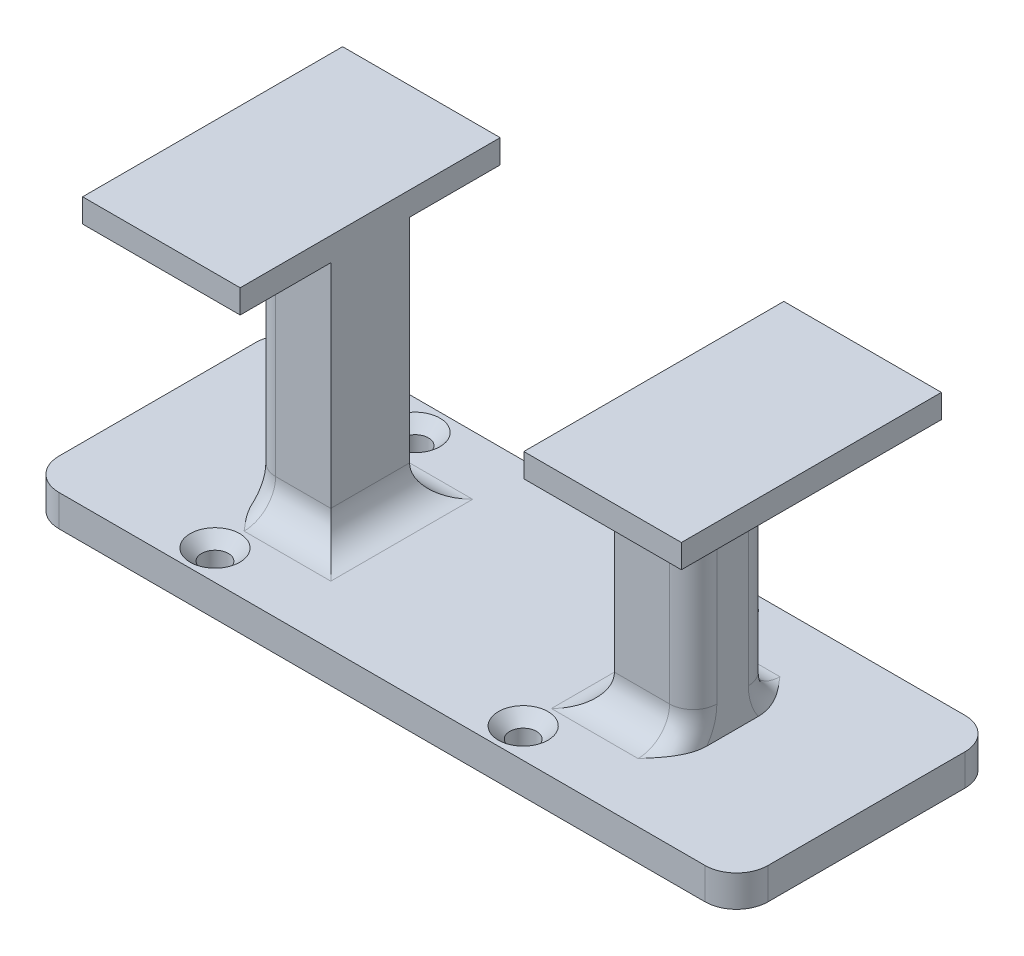
from build123d import *

# Parameters (mm, degrees)
ESQUISSE1_W                                    = 90
ESQUISSE1_H                                    = 33
BOSS_EXTRU_1_DEPTH                             = 4
ESQUISSE2_R                                    = 1.5
ENL_V_MAT_EXTRU_1_DEPTH                        = 4
ESQUISSE3_W                                    = 10
ESQUISSE3_H                                    = 10
BOSS_EXTRU_2_DEPTH                             = 31
ESQUISSE4_W                                    = 20
ESQUISSE4_H                                    = 33
BOSS_EXTRU_3_DEPTH                             = 3
CONG_1_R                                       = 4
FRAISAGE_POUR_VIS_T_TE_FRAIS_E_M31_D           = 3.4
FRAISAGE_POUR_VIS_T_TE_FRAIS_E_M31_DEPTH       = 10
FRAISAGE_POUR_VIS_T_TE_FRAIS_E_M31_CSINK_D     = 6.3
FRAISAGE_POUR_VIS_T_TE_FRAIS_E_M31_CSINK_ANGLE = 90
FRAISAGE_POUR_VIS_T_TE_FRAIS_E_M31_TIP         = 1.021463052
CONG_2_R                                       = 3


with BuildPart() as part:
    # Esquisse1 → Boss.-Extru.1 (new body)
    with BuildSketch(Plane(origin=(0, 0, 0), x_dir=(1, 0, 0), z_dir=(0, 1, 0))):
        with Locations((45, 16.5)):
            Rectangle(ESQUISSE1_W, ESQUISSE1_H)
    extrude(amount=BOSS_EXTRU_1_DEPTH)

    # Esquisse2 → Enlèv. mat.-Extru.1 (cut)
    with BuildSketch(Plane(origin=(0, 4, 0), x_dir=(1, 0, 0), z_dir=(0, 1, 0))):
        with Locations(Location((20, 29.2, 0), (0, 0, 270))):
            Circle(ESQUISSE2_R)
        with Locations(Location((59.12, 29.2, 0), (0, 0, 270))):
            Circle(ESQUISSE2_R)
        with Locations(Location((59.12, 3.8, 0), (0, 0, 270))):
            Circle(ESQUISSE2_R)
        with Locations(Location((20, 3.8, 0), (0, 0, 270))):
            Circle(ESQUISSE2_R)
    extrude(amount=-ENL_V_MAT_EXTRU_1_DEPTH, mode=Mode.SUBTRACT)

    # Esquisse3 → Boss.-Extru.2 (add)
    with BuildSketch(Plane(origin=(0, 4, 0), x_dir=(1, 0, 0), z_dir=(0, 1, 0))):
        with Locations((22, 16.5)):
            Rectangle(ESQUISSE3_W, ESQUISSE3_H)
        with Locations((68, 16.5)):
            Rectangle(ESQUISSE3_W, ESQUISSE3_H)
    extrude(amount=BOSS_EXTRU_2_DEPTH)

    # Esquisse4 → Boss.-Extru.3 (add)
    with BuildSketch(Plane(origin=(0, 35, 0), x_dir=(1, 0, 0), z_dir=(0, 1, 0))):
        with Locations((17, 16.5)):
            Rectangle(ESQUISSE4_W, ESQUISSE4_H)
        with Locations((73, 16.5)):
            Rectangle(ESQUISSE4_W, ESQUISSE4_H)
    extrude(amount=BOSS_EXTRU_3_DEPTH)

    # Congé1
    cong_1_edges = [part.edges().sort_by_distance(p)[0] for p in [
        (22, 4, -11.5),
        (27, 4, -16.5),
        (22, 4, -21.5),
        (63, 4, -16.5),
        (68, 4, -11.5),
        (68, 4, -21.5),
        (0, 2, -33),
        (90, 2, -33),
        (90, 2, 0),
        (0, 2, 0),
    ]]
    fillet(cong_1_edges, radius=CONG_1_R)

    # Fraisage pour vis à tête fraisée M31
    with Locations(Plane(origin=(0, 4, 0), x_dir=(1, 0, 0), z_dir=(0, 1, 0))):
        with Locations((59.12, 3.8), (59.12, 29.2), (20, 3.8), (20, 29.2)):
            CounterSinkHole(FRAISAGE_POUR_VIS_T_TE_FRAIS_E_M31_D / 2, FRAISAGE_POUR_VIS_T_TE_FRAIS_E_M31_CSINK_D / 2, depth=FRAISAGE_POUR_VIS_T_TE_FRAIS_E_M31_DEPTH, counter_sink_angle=FRAISAGE_POUR_VIS_T_TE_FRAIS_E_M31_CSINK_ANGLE)
            with Locations((0, 0, -(FRAISAGE_POUR_VIS_T_TE_FRAIS_E_M31_DEPTH + FRAISAGE_POUR_VIS_T_TE_FRAIS_E_M31_TIP / 2))):  # 118° drill point
                Cone(0, FRAISAGE_POUR_VIS_T_TE_FRAIS_E_M31_D / 2, FRAISAGE_POUR_VIS_T_TE_FRAIS_E_M31_TIP, mode=Mode.SUBTRACT)

    # Congé2
    # the kernel refuses this fillet: 3 mm, written as the material it takes off along each edge
    with BuildSketch(Plane(origin=(17, 8, -25.5), x_dir=(0, 0, 1), z_dir=(0, 1, 0))) as cong_2_piece_1_section:
        with BuildLine():
            CenterArc((4 + CONG_2_R, CONG_2_R), CONG_2_R, 180, 90)
            Line((4, CONG_2_R), (4, 0))
            Line((4, 0), (4 + CONG_2_R, 0))
        make_face()
    cong_2_piece_1 = revolve(axis=Axis((17, 8, -25.5), (1, 0, 0)), revolution_arc=197.472741928, mode=Mode.PRIVATE)
    cong_2_piece_1 = split(cong_2_piece_1, bisect_by=Plane(origin=(17, 4, -25.5), z_dir=(0, 1, 0)), keep=Keep.TOP, mode=Mode.PRIVATE)
    add(cong_2_piece_1, mode=Mode.SUBTRACT)
    with BuildSketch(Plane(origin=(73, 8, -25.5), x_dir=(0, 0.3002520412299313, -0.9538599015249879), z_dir=(0, 0.9538599015249879, 0.3002520412299313))) as cong_2_piece_2_section:
        with BuildLine():
            CenterArc((4 + CONG_2_R, CONG_2_R), CONG_2_R, 180, 90)
            Line((4, CONG_2_R), (4, 0))
            Line((4, 0), (4 + CONG_2_R, 0))
        make_face()
    cong_2_piece_2 = revolve(axis=Axis((73, 8, -25.5), (-1, 0, 0)), revolution_arc=197.472741928, mode=Mode.PRIVATE)
    cong_2_piece_2 = split(cong_2_piece_2, bisect_by=Plane(origin=(73, 4, -25.5), z_dir=(0, 1, 0)), keep=Keep.TOP, mode=Mode.PRIVATE)
    add(cong_2_piece_2, mode=Mode.SUBTRACT)
    with BuildSketch(Plane(origin=(73, 8, -7.5), x_dir=(0, 0.30025204122993077, 0.9538599015249881), z_dir=(0, 0.9538599015249881, -0.30025204122993077))) as cong_2_piece_3_section:
        with BuildLine():
            CenterArc((4 + CONG_2_R, -CONG_2_R), CONG_2_R, 90, 90)
            Line((4, -CONG_2_R), (4, 0))
            Line((4, 0), (4 + CONG_2_R, 0))
        make_face()
    cong_2_piece_3 = revolve(axis=Axis((73, 8, -7.5), (1, 0, 0)), revolution_arc=197.472741928, mode=Mode.PRIVATE)
    cong_2_piece_3 = split(cong_2_piece_3, bisect_by=Plane(origin=(73, 4, -7.5), z_dir=(0, 1, 0)), keep=Keep.TOP, mode=Mode.PRIVATE)
    add(cong_2_piece_3, mode=Mode.SUBTRACT)
    with BuildSketch(Plane(origin=(17, 8, -7.5), x_dir=(0, 0, -1), z_dir=(0, 1, 0))) as cong_2_piece_4_section:
        with BuildLine():
            CenterArc((4 + CONG_2_R, -CONG_2_R), CONG_2_R, 90, 90)
            Line((4, -CONG_2_R), (4, 0))
            Line((4, 0), (4 + CONG_2_R, 0))
        make_face()
    cong_2_piece_4 = revolve(axis=Axis((17, 8, -7.5), (-1, 0, 0)), revolution_arc=197.472741928, mode=Mode.PRIVATE)
    cong_2_piece_4 = split(cong_2_piece_4, bisect_by=Plane(origin=(17, 4, -7.5), z_dir=(0, 1, 0)), keep=Keep.TOP, mode=Mode.PRIVATE)
    add(cong_2_piece_4, mode=Mode.SUBTRACT)
    with BuildSketch(Plane(origin=(17, 8, -21.5), x_dir=(0, 0, 1), z_dir=(0, 1, 0)), Plane(origin=(17, 8, -11.5), x_dir=(1, 0, 0), z_dir=(0, 1, 0)), Plane(origin=(73, 8, -11.5), x_dir=(0, 0, -1), z_dir=(0, 1, 0))) as cong_2_piece_5:
        with BuildLine():
            CenterArc((CONG_2_R, CONG_2_R), CONG_2_R, 180, 90)
            Line((0, CONG_2_R), (0, 0))
            Line((0, 0), (CONG_2_R, 0))
        make_face()
    extrude(amount=27, mode=Mode.SUBTRACT)
    with BuildSketch(Plane(origin=(73, 8, -21.5), x_dir=(0, 0, 1), z_dir=(0, 1, 0))) as cong_2_piece_6:
        with BuildLine():
            CenterArc((CONG_2_R, -CONG_2_R), CONG_2_R, 90, 90)
            Line((0, -CONG_2_R), (0, 0))
            Line((0, 0), (CONG_2_R, 0))
        make_face()
    extrude(amount=27, mode=Mode.SUBTRACT)


solid = part.part
